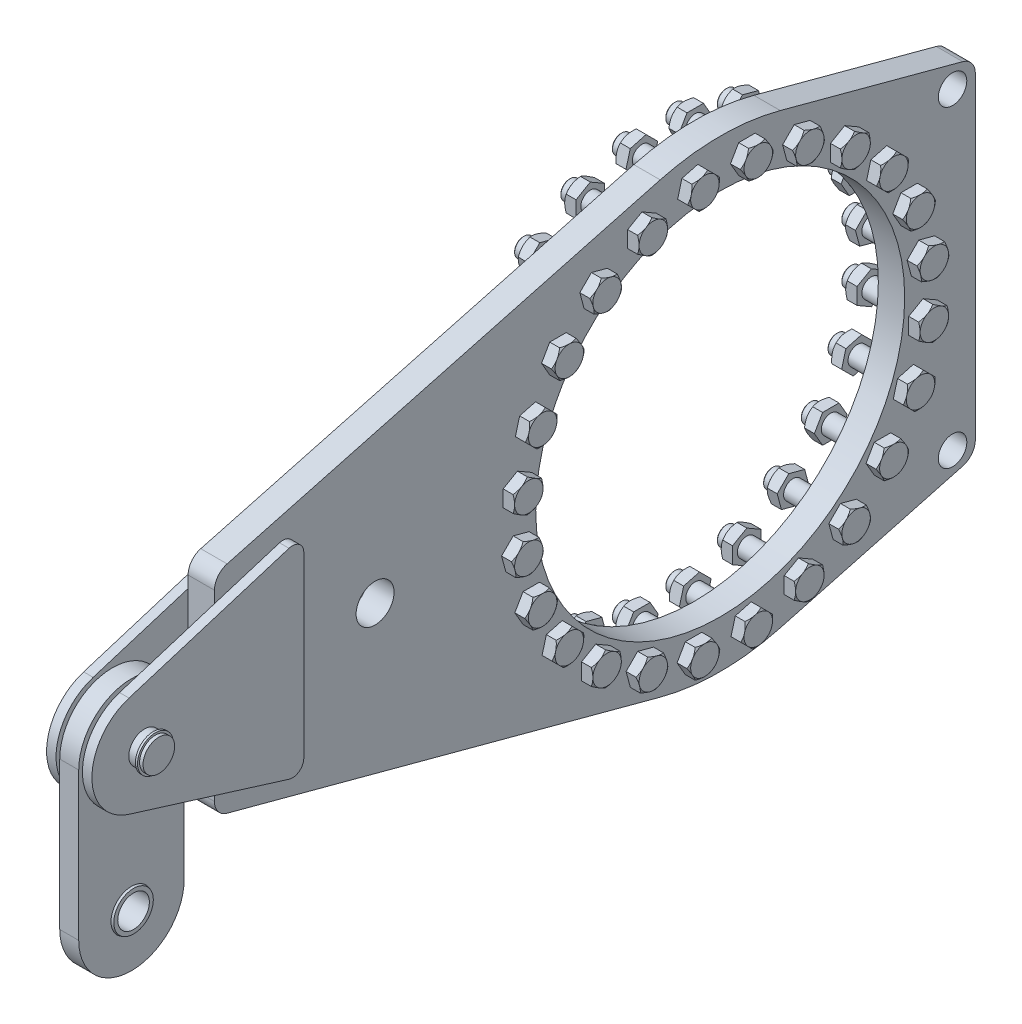
from build123d import *

# Parameters (mm, degrees)
SKETCH_3_R                            = 175
SKETCH_3_R_2                          = 13.5
SKETCH_3_R_3                          = 18
EXTRUDE_1_DEPTH                       = 12.5
EXTRUDE_START                         = 21.5
SKETCH_5_R                            = 15
EXTRUDE_2_DEPTH                       = 9
FILLET_1_R                            = 10.8
FILLET_1_OF_MIRROR_1_R                = 10.8
CUT_EXTRUDE_START                     = -12.5
SKETCH_6_R                            = 9
CUT_EXTRUDE_1_DEPTH                   = 25
PATTERN_CIRCULAR_1_COUNT              = 24
EXTRUDE_START_2                       = -9
SKETCH_7_R                            = 15
EXTRUDE_3_DEPTH                       = 18
PATTERN_LINEAR_1_COUNT                = 2
PATTERN_LINEAR_1_PITCH                = 140
EXTRUDE_3080_DEPTH                    = 10.8
SKETCH_21_R                           = 17.676914536
SKETCH_21_R_2                         = 13.5
CUT_EXTRUDE_3418_DEPTH                = 1.8
CUT_EXTRUDE_3418_DRAFT                = -55
EXTRUDE_START_3                       = -56.3
SKETCH_22_R                           = 9
EXTRUDE_6_DEPTH                       = 68.8
CHAMFER_1_SIZE                        = 0.9
EXTRUDE_START_4                       = -36.5
EXTRUDE_7_DEPTH                       = 10.8
PATTERN_CIRCULAR_2_COUNT              = 24
PATTERN_CIRCULAR_2_COPY_1_SKETCH_R    = 17.676914536
PATTERN_CIRCULAR_2_COPY_1_SKETCH_R_2  = 13.5
PATTERN_CIRCULAR_2_COPY_1_DEPTH       = 1.8
PATTERN_CIRCULAR_2_COPY_1_DRAFT       = -55
PATTERN_CIRCULAR_2_COPY_2_SKETCH_R    = 17.676914536
PATTERN_CIRCULAR_2_COPY_2_SKETCH_R_2  = 13.5
PATTERN_CIRCULAR_2_COPY_2_DEPTH       = 1.8
PATTERN_CIRCULAR_2_COPY_2_DRAFT       = -55
PATTERN_CIRCULAR_2_COPY_3_SKETCH_R    = 17.676914536
PATTERN_CIRCULAR_2_COPY_3_SKETCH_R_2  = 13.5
PATTERN_CIRCULAR_2_COPY_3_DEPTH       = 1.8
PATTERN_CIRCULAR_2_COPY_3_DRAFT       = -55
PATTERN_CIRCULAR_2_COPY_4_SKETCH_R    = 17.676914536
PATTERN_CIRCULAR_2_COPY_4_SKETCH_R_2  = 13.5
PATTERN_CIRCULAR_2_COPY_4_DEPTH       = 1.8
PATTERN_CIRCULAR_2_COPY_4_DRAFT       = -55
PATTERN_CIRCULAR_2_COPY_5_SKETCH_R    = 17.676914536
PATTERN_CIRCULAR_2_COPY_5_SKETCH_R_2  = 13.5
PATTERN_CIRCULAR_2_COPY_5_DEPTH       = 1.8
PATTERN_CIRCULAR_2_COPY_5_DRAFT       = -55
PATTERN_CIRCULAR_2_COPY_6_SKETCH_R    = 17.676914536
PATTERN_CIRCULAR_2_COPY_6_SKETCH_R_2  = 13.5
PATTERN_CIRCULAR_2_COPY_6_DEPTH       = 1.8
PATTERN_CIRCULAR_2_COPY_6_DRAFT       = -55
PATTERN_CIRCULAR_2_COPY_7_SKETCH_R    = 17.676914536
PATTERN_CIRCULAR_2_COPY_7_SKETCH_R_2  = 13.5
PATTERN_CIRCULAR_2_COPY_7_DEPTH       = 1.8
PATTERN_CIRCULAR_2_COPY_7_DRAFT       = -55
PATTERN_CIRCULAR_2_COPY_8_SKETCH_R    = 17.676914536
PATTERN_CIRCULAR_2_COPY_8_SKETCH_R_2  = 13.5
PATTERN_CIRCULAR_2_COPY_8_DEPTH       = 1.8
PATTERN_CIRCULAR_2_COPY_8_DRAFT       = -55
PATTERN_CIRCULAR_2_COPY_9_SKETCH_R    = 17.676914536
PATTERN_CIRCULAR_2_COPY_9_SKETCH_R_2  = 13.5
PATTERN_CIRCULAR_2_COPY_9_DEPTH       = 1.8
PATTERN_CIRCULAR_2_COPY_9_DRAFT       = -55
PATTERN_CIRCULAR_2_COPY_10_SKETCH_R   = 17.676914536
PATTERN_CIRCULAR_2_COPY_10_SKETCH_R_2 = 13.5
PATTERN_CIRCULAR_2_COPY_10_DEPTH      = 1.8
PATTERN_CIRCULAR_2_COPY_10_DRAFT      = -55
PATTERN_CIRCULAR_2_COPY_11_SKETCH_R   = 17.676914536
PATTERN_CIRCULAR_2_COPY_11_SKETCH_R_2 = 13.5
PATTERN_CIRCULAR_2_COPY_11_DEPTH      = 1.8
PATTERN_CIRCULAR_2_COPY_11_DRAFT      = -55
PATTERN_CIRCULAR_2_COPY_12_SKETCH_R   = 17.676914536
PATTERN_CIRCULAR_2_COPY_12_SKETCH_R_2 = 13.5
PATTERN_CIRCULAR_2_COPY_12_DEPTH      = 1.8
PATTERN_CIRCULAR_2_COPY_12_DRAFT      = -55
PATTERN_CIRCULAR_2_COPY_13_SKETCH_R   = 17.676914536
PATTERN_CIRCULAR_2_COPY_13_SKETCH_R_2 = 13.5
PATTERN_CIRCULAR_2_COPY_13_DEPTH      = 1.8
PATTERN_CIRCULAR_2_COPY_13_DRAFT      = -55
PATTERN_CIRCULAR_2_COPY_14_SKETCH_R   = 17.676914536
PATTERN_CIRCULAR_2_COPY_14_SKETCH_R_2 = 13.5
PATTERN_CIRCULAR_2_COPY_14_DEPTH      = 1.8
PATTERN_CIRCULAR_2_COPY_14_DRAFT      = -55
PATTERN_CIRCULAR_2_COPY_15_SKETCH_R   = 17.676914536
PATTERN_CIRCULAR_2_COPY_15_SKETCH_R_2 = 13.5
PATTERN_CIRCULAR_2_COPY_15_DEPTH      = 1.8
PATTERN_CIRCULAR_2_COPY_15_DRAFT      = -55
PATTERN_CIRCULAR_2_COPY_16_SKETCH_R   = 17.676914536
PATTERN_CIRCULAR_2_COPY_16_SKETCH_R_2 = 13.5
PATTERN_CIRCULAR_2_COPY_16_DEPTH      = 1.8
PATTERN_CIRCULAR_2_COPY_16_DRAFT      = -55
PATTERN_CIRCULAR_2_COPY_17_SKETCH_R   = 17.676914536
PATTERN_CIRCULAR_2_COPY_17_SKETCH_R_2 = 13.5
PATTERN_CIRCULAR_2_COPY_17_DEPTH      = 1.8
PATTERN_CIRCULAR_2_COPY_17_DRAFT      = -55
PATTERN_CIRCULAR_2_COPY_18_SKETCH_R   = 17.676914536
PATTERN_CIRCULAR_2_COPY_18_SKETCH_R_2 = 13.5
PATTERN_CIRCULAR_2_COPY_18_DEPTH      = 1.8
PATTERN_CIRCULAR_2_COPY_18_DRAFT      = -55
PATTERN_CIRCULAR_2_COPY_19_SKETCH_R   = 17.676914536
PATTERN_CIRCULAR_2_COPY_19_SKETCH_R_2 = 13.5
PATTERN_CIRCULAR_2_COPY_19_DEPTH      = 1.8
PATTERN_CIRCULAR_2_COPY_19_DRAFT      = -55
PATTERN_CIRCULAR_2_COPY_20_SKETCH_R   = 17.676914536
PATTERN_CIRCULAR_2_COPY_20_SKETCH_R_2 = 13.5
PATTERN_CIRCULAR_2_COPY_20_DEPTH      = 1.8
PATTERN_CIRCULAR_2_COPY_20_DRAFT      = -55
PATTERN_CIRCULAR_2_COPY_21_SKETCH_R   = 17.676914536
PATTERN_CIRCULAR_2_COPY_21_SKETCH_R_2 = 13.5
PATTERN_CIRCULAR_2_COPY_21_DEPTH      = 1.8
PATTERN_CIRCULAR_2_COPY_21_DRAFT      = -55
PATTERN_CIRCULAR_2_COPY_22_SKETCH_R   = 17.676914536
PATTERN_CIRCULAR_2_COPY_22_SKETCH_R_2 = 13.5
PATTERN_CIRCULAR_2_COPY_22_DEPTH      = 1.8
PATTERN_CIRCULAR_2_COPY_22_DRAFT      = -55
PATTERN_CIRCULAR_2_COPY_23_SKETCH_R   = 17.676914536
PATTERN_CIRCULAR_2_COPY_23_SKETCH_R_2 = 13.5
PATTERN_CIRCULAR_2_COPY_23_DEPTH      = 1.8
PATTERN_CIRCULAR_2_COPY_23_DRAFT      = -55
CHAMFER_1_OF_PATTERN_CIRCULAR_2_SIZE  = 0.9
FILLET_2_R                            = 16.2


# Read off the part's stored shape, not the designer's step: 切除-拉伸3
with BuildPart() as part:
    # 草图3 → 凸台-拉伸1 (new body)
    with BuildSketch(Plane(origin=(0, 0, 0), x_dir=(0, 0, -1), z_dir=(1, 0, 0))):
        with BuildLine():
            Line((-56.940189923, 212.503681784), (-479.75, 99.212134621))
            Line((-479.75, 99.212134621), (-479.75, -99.212134621))
            Line((-479.75, -99.212134621), (-56.940189923, -212.503681784))
            ThreePointArc((-56.940189923, -212.503681784), (0, -220), (56.940189923, -212.503681784))
            Line((56.940189923, -212.503681784), (242, -162.917055122))
            Line((242, -162.917055122), (242, 162.917055122))
            Line((242, 162.917055122), (56.940189923, 212.503681784))
            ThreePointArc((56.940189923, 212.503681784), (0, 220), (-56.940189923, 212.503681784))
        make_face()
        Circle(SKETCH_3_R, mode=Mode.SUBTRACT)
        with Locations((220.4, 148.375698136)):
            Circle(SKETCH_3_R_2, mode=Mode.SUBTRACT)
        with Locations((-327.375, 0)):
            Circle(SKETCH_3_R_3, mode=Mode.SUBTRACT)
        with Locations(Location((220.4, -148.375698136, 0), (0, 0, 180))):
            Circle(SKETCH_3_R_2, mode=Mode.SUBTRACT)
    extrude_1 = extrude(amount=EXTRUDE_1_DEPTH)

    # 草图5 → 凸台-拉伸2 (add)
    with BuildSketch(Plane(origin=(0, 0, 0), x_dir=(0, 0, -1), z_dir=(1, 0, 0)).offset(EXTRUDE_START)):
        with BuildLine():
            Line((-569.819319965, -47.753405698), (-404, -99.212134621))
            Line((-404, -99.212134621), (-404, 99.212134621))
            Line((-404, 99.212134621), (-569.819319965, 47.753405698))
            ThreePointArc((-569.819319965, 47.753405698), (-595.255223253, 29.656651882), (-605, 0))
            ThreePointArc((-605, 0), (-595.255223253, -29.656651882), (-569.819319965, -47.753405698))
        make_face()
        with Locations((-555, 0)):
            Circle(SKETCH_5_R, mode=Mode.SUBTRACT)
    extrude_2 = extrude(amount=-EXTRUDE_2_DEPTH)

    # 圆角1
    fillet_1_edges = [part.edges().sort_by_distance(p)[0] for p in [
        (17, -99.212134621, 404),
        (17, 99.212134621, 404),
    ]]
    fillet(fillet_1_edges, radius=FILLET_1_R)

    # 镜向1: 凸台-拉伸1, 凸台-拉伸2 across plane
    add(extrude_1.mirror(Plane(origin=(0, 0, 0), x_dir=(0, 0, 1), z_dir=(1, 0, 0))))
    add(extrude_2.mirror(Plane(origin=(0, 0, 0), x_dir=(0, 0, 1), z_dir=(1, 0, 0))))

    # 圆角1 of 镜向1
    fillet_1_of_mirror_1_edges = [part.edges().sort_by_distance(p)[0] for p in [
        (-17, -99.212134621, 404),
        (-17, 99.212134621, 404),
    ]]
    fillet(fillet_1_of_mirror_1_edges, radius=FILLET_1_OF_MIRROR_1_R)

    # 草图6 → 切除-拉伸1 (cut)
    with BuildSketch(Plane(origin=(0, 0, 0), x_dir=(0, 0, -1), z_dir=(1, 0, 0)).offset(CUT_EXTRUDE_START)):
        with Locations((25.322081291, 192.340303107)):
            Circle(SKETCH_6_R)
    cut_extrude_1 = extrude(amount=CUT_EXTRUDE_1_DEPTH, mode=Mode.SUBTRACT)

    # 阵列(圆周)1: 切除-拉伸1 ×24 about axis
    pattern_circular_1_axis = Axis((0, 0, 0), (1, 0, 0))
    for i in range(1, PATTERN_CIRCULAR_1_COUNT):
        add(cut_extrude_1.rotate(pattern_circular_1_axis, i * 360 / PATTERN_CIRCULAR_1_COUNT), mode=Mode.SUBTRACT)



with BuildPart() as body_2:
    # 草图7 → 凸台-拉伸3 (new body)
    with BuildSketch(Plane(origin=(0, 0, 0), x_dir=(0, 0, -1), z_dir=(1, 0, 0)).offset(EXTRUDE_START_2)):
        with BuildLine():
            Line((-605, 0), (-605, -140))
            ThreePointArc((-605, -140), (-555, -190), (-505, -140))
            Line((-505, -140), (-505, 0))
            ThreePointArc((-505, 0), (-555, 50), (-605, 0))
        make_face()
        with Locations((-555, 0)):
            Circle(SKETCH_7_R, mode=Mode.SUBTRACT)
        with Locations((-555, -140)):
            Circle(SKETCH_7_R, mode=Mode.SUBTRACT)
    extrude(amount=EXTRUDE_3_DEPTH)

    # 草图9 → 旋转1 (revolve)
    with BuildSketch(Plane.XY.offset(555), mode=Mode.PRIVATE) as revolve_1_sk:
        with BuildLine():
            Line((-11, 15), (-11, 18.75))
            ThreePointArc((-11, 18.75), (0, 20.625), (11, 18.75))
            Line((11, 18.75), (11, 15))
            Line((11, 15), (-11, 15))
        make_face()
    revolve_1 = revolve(revolve_1_sk.sketch.rotate(Axis((11, 0, 555), (-1, 0, 0)), 90), axis=Axis((11, 0, 555), (-1, 0, 0)))

    # 阵列(线性)1: 旋转1 ×2
    with Locations(*[(0, -i * PATTERN_LINEAR_1_PITCH, 0) for i in range(1, PATTERN_LINEAR_1_COUNT)]):
        add(revolve_1)


with BuildPart() as part_1:
    add(part.part)

    add(body_2.part)  # 旋转2 merges body 2
    # 草图12 → 旋转2 (revolve)
    with BuildSketch(Plane.XY.offset(555), mode=Mode.PRIVATE) as revolve_2_sk:
        Polygon((-35, 0), (-35, 15), (-31.75, 15), (-31.75, 17), (-29.75, 17), (-29.75, 15), (29.75, 15), (29.75, 17), (31.75, 17), (31.75, 15), (35, 15), (35, 0), align=None)
    revolve(revolve_2_sk.sketch.rotate(Axis((-35, 0, 555), (1, 0, 0)), 90), axis=Axis((-35, 0, 555), (1, 0, 0)))

    # 草图14 → Extrude 3080 (add)
    with BuildSketch(Plane(origin=(12.5, 197.357127416, 57.456147132), x_dir=(0, 0, -1), z_dir=(1, 0, 0))):
        Polygon((67.189771155, -5.016824309), (74.983999789, -18.516824309), (90.572457057, -18.516824309), (98.366685691, -5.016824309), (90.572457057, 8.483175691), (74.983999789, 8.483175691), align=None)
    extrude_3080 = extrude(amount=EXTRUDE_3080_DEPTH)


with BuildPart() as cut_extrude_3418_tool:
    # 草图21 → Cut-Extrude 3418 (with draft: the straight prism first)
    with BuildSketch(Plane(origin=(23.3, 192.340303107, -25.322081291), x_dir=(0, 0, -1), z_dir=(1, 0, 0))):
        Circle(SKETCH_21_R)
        Circle(SKETCH_21_R_2, mode=Mode.SUBTRACT)
    extrude(amount=-CUT_EXTRUDE_3418_DEPTH)
    # Cut-Extrude 3418: the draft: its side faces are tilted about the plane it starts from
    cut_extrude_3418_sides = [cut_extrude_3418_tool.faces().sort_by_distance(p)[0] for p in [
        (22.4, 192.340303107, -7.645166754),
        (22.4, 192.340303107, -11.822081291),
    ]]
    draft(cut_extrude_3418_sides, Plane(origin=(23.3, 192.340303107, -25.322081291), x_dir=(0, 0, -1), z_dir=(1, 0, 0)), CUT_EXTRUDE_3418_DRAFT)


with BuildPart() as part_2:
    add(part_1.part)

    # Cut-Extrude 3418: cut by cut_extrude_3418_tool
    add(cut_extrude_3418_tool.part, mode=Mode.SUBTRACT)

    # 草图22 → 凸台-拉伸6 (add)
    with BuildSketch(Plane(origin=(0, 0, 0), x_dir=(0, 0, -1), z_dir=(1, 0, 0)).offset(EXTRUDE_START_3)):
        with Locations((25.322081291, 192.340303107)):
            Circle(SKETCH_22_R)
    extrude_6 = extrude(amount=EXTRUDE_6_DEPTH)

    # 倒角1
    chamfer_1_edges = [part_2.edges().sort_by_distance(p)[0] for p in [
        (-56.3, 192.340303107, -16.322081291),
    ]]
    chamfer(chamfer_1_edges, length=CHAMFER_1_SIZE)

    # 草图23 → 凸台-拉伸7 (add)
    with BuildSketch(Plane(origin=(0, 0, 0), x_dir=(0, 0, -1), z_dir=(1, 0, 0)).offset(EXTRUDE_START_4)):
        Polygon((40.910538559, 192.340303107), (33.116309925, 205.840303107), (17.527852657, 205.840303107), (9.733624023, 192.340303107), (17.527852657, 178.840303107), (33.116309925, 178.840303107), align=None)
    extrude_7 = extrude(amount=-EXTRUDE_7_DEPTH)

    # 切除-拉伸3 outline → 切除-拉伸3 (revolve, cut)
    with BuildSketch(Plane(origin=(0, 192.340303107, -25.322081291), x_dir=(0, 1, 0), z_dir=(0, 0, -1))):
        Polygon((15.588457272, -45.837646475), (13.5, -47.3), (15.588457272, -47.300000159), align=None)
    cut_extrude_3 = revolve(axis=Axis((0, 192.340303107, -25.322081291), (1, 0, 0)), mode=Mode.SUBTRACT)

    # 阵列(圆周)2: Extrude 3080, 凸台-拉伸6, 凸台-拉伸7, 切除-拉伸3 ×24 about axis
    pattern_circular_2_axis = Axis((0, 0, 0), (1, 0, 0))
    add([extrude_3080.rotate(pattern_circular_2_axis, i * 360 / PATTERN_CIRCULAR_2_COUNT) for i in range(1, PATTERN_CIRCULAR_2_COUNT)])
    add([extrude_6.rotate(pattern_circular_2_axis, i * 360 / PATTERN_CIRCULAR_2_COUNT) for i in range(1, PATTERN_CIRCULAR_2_COUNT)])
    add([extrude_7.rotate(pattern_circular_2_axis, i * 360 / PATTERN_CIRCULAR_2_COUNT) for i in range(1, PATTERN_CIRCULAR_2_COUNT)])
    add([cut_extrude_3.rotate(pattern_circular_2_axis, i * 360 / PATTERN_CIRCULAR_2_COUNT) for i in range(1, PATTERN_CIRCULAR_2_COUNT)], mode=Mode.SUBTRACT)


with BuildPart() as pattern_circular_2_copy_1_tool:
    # 阵列(圆周)2 copy 1 sketch → 阵列(圆周)2 copy 1 (with draft: the straight prism first)
    with BuildSketch(Plane(origin=(23.3, 192.340303107, 25.322081291), x_dir=(0, 0.25881904510252074, -0.9659258262890683), z_dir=(1, 0, 0))):
        Circle(PATTERN_CIRCULAR_2_COPY_1_SKETCH_R)
        Circle(PATTERN_CIRCULAR_2_COPY_1_SKETCH_R_2, mode=Mode.SUBTRACT)
    extrude(amount=-PATTERN_CIRCULAR_2_COPY_1_DEPTH)
    # 阵列(圆周)2 copy 1: the draft: its side faces are tilted about the plane it starts from
    pattern_circular_2_copy_1_sides = [pattern_circular_2_copy_1_tool.faces().sort_by_distance(p)[0] for p in [
        (22.4, 187.765180966, 42.396669571),
        (22.4, 188.846245998, 38.362079945),
    ]]
    draft(pattern_circular_2_copy_1_sides, Plane(origin=(23.3, 192.340303107, 25.322081291), x_dir=(0, 0.25881904510252074, -0.9659258262890683), z_dir=(1, 0, 0)), PATTERN_CIRCULAR_2_COPY_1_DRAFT)


with BuildPart() as part_3:
    add(part_2.part)

    # 阵列(圆周)2 copy 1: cut by pattern_circular_2_copy_1_tool
    add(pattern_circular_2_copy_1_tool.part, mode=Mode.SUBTRACT)


with BuildPart() as pattern_circular_2_copy_2_tool:
    # 阵列(圆周)2 copy 2 sketch → 阵列(圆周)2 copy 2 (with draft: the straight prism first)
    with BuildSketch(Plane(origin=(23.3, 179.232629307, 74.240585879), x_dir=(0, 0.49999999999999994, -0.8660254037844387), z_dir=(1, 0, 0))):
        Circle(PATTERN_CIRCULAR_2_COPY_2_SKETCH_R)
        Circle(PATTERN_CIRCULAR_2_COPY_2_SKETCH_R_2, mode=Mode.SUBTRACT)
    extrude(amount=-PATTERN_CIRCULAR_2_COPY_2_DEPTH)
    # 阵列(圆周)2 copy 2: the draft: its side faces are tilted about the plane it starts from
    pattern_circular_2_copy_2_sides = [pattern_circular_2_copy_2_tool.faces().sort_by_distance(p)[0] for p in [
        (22.4, 170.394172039, 89.549242928),
        (22.4, 172.482629308, 85.93192883),
    ]]
    draft(pattern_circular_2_copy_2_sides, Plane(origin=(23.3, 179.232629307, 74.240585879), x_dir=(0, 0.49999999999999994, -0.8660254037844387), z_dir=(1, 0, 0)), PATTERN_CIRCULAR_2_COPY_2_DRAFT)


with BuildPart() as part_4:
    add(part_3.part)

    # 阵列(圆周)2 copy 2: cut by pattern_circular_2_copy_2_tool
    add(pattern_circular_2_copy_2_tool.part, mode=Mode.SUBTRACT)


with BuildPart() as pattern_circular_2_copy_3_tool:
    # 阵列(圆周)2 copy 3 sketch → 阵列(圆周)2 copy 3 (with draft: the straight prism first)
    with BuildSketch(Plane(origin=(23.3, 153.910548016, 118.099717228), x_dir=(0, 0.7071067811865475, -0.7071067811865476), z_dir=(1, 0, 0))):
        Circle(PATTERN_CIRCULAR_2_COPY_3_SKETCH_R)
        Circle(PATTERN_CIRCULAR_2_COPY_3_SKETCH_R_2, mode=Mode.SUBTRACT)
    extrude(amount=-PATTERN_CIRCULAR_2_COPY_3_DEPTH)
    # 阵列(圆周)2 copy 3: the draft: its side faces are tilted about the plane it starts from
    pattern_circular_2_copy_3_sides = [pattern_circular_2_copy_3_tool.faces().sort_by_distance(p)[0] for p in [
        (22.4, 141.411081877, 130.599183367),
        (22.4, 144.364606471, 127.645658774),
    ]]
    draft(pattern_circular_2_copy_3_sides, Plane(origin=(23.3, 153.910548016, 118.099717228), x_dir=(0, 0.7071067811865475, -0.7071067811865476), z_dir=(1, 0, 0)), PATTERN_CIRCULAR_2_COPY_3_DRAFT)


with BuildPart() as part_5:
    add(part_4.part)

    # 阵列(圆周)2 copy 3: cut by pattern_circular_2_copy_3_tool
    add(pattern_circular_2_copy_3_tool.part, mode=Mode.SUBTRACT)


with BuildPart() as pattern_circular_2_copy_4_tool:
    # 阵列(圆周)2 copy 4 sketch → 阵列(圆周)2 copy 4 (with draft: the straight prism first)
    with BuildSketch(Plane(origin=(23.3, 118.099717228, 153.910548017), x_dir=(0, 0.8660254037844386, -0.5000000000000001), z_dir=(1, 0, 0))):
        Circle(PATTERN_CIRCULAR_2_COPY_4_SKETCH_R)
        Circle(PATTERN_CIRCULAR_2_COPY_4_SKETCH_R_2, mode=Mode.SUBTRACT)
    extrude(amount=-PATTERN_CIRCULAR_2_COPY_4_DEPTH)
    # 阵列(圆周)2 copy 4: the draft: its side faces are tilted about the plane it starts from
    pattern_circular_2_copy_4_sides = [pattern_circular_2_copy_4_tool.faces().sort_by_distance(p)[0] for p in [
        (22.4, 102.791060179, 162.749005285),
        (22.4, 106.408374277, 160.660548017),
    ]]
    draft(pattern_circular_2_copy_4_sides, Plane(origin=(23.3, 118.099717228, 153.910548017), x_dir=(0, 0.8660254037844386, -0.5000000000000001), z_dir=(1, 0, 0)), PATTERN_CIRCULAR_2_COPY_4_DRAFT)


with BuildPart() as part_6:
    add(part_5.part)

    # 阵列(圆周)2 copy 4: cut by pattern_circular_2_copy_4_tool
    add(pattern_circular_2_copy_4_tool.part, mode=Mode.SUBTRACT)


with BuildPart() as pattern_circular_2_copy_5_tool:
    # 阵列(圆周)2 copy 5 sketch → 阵列(圆周)2 copy 5 (with draft: the straight prism first)
    with BuildSketch(Plane(origin=(23.3, 74.240585879, 179.232629307), x_dir=(0, 0.9659258262890683, -0.25881904510252074), z_dir=(1, 0, 0))):
        Circle(PATTERN_CIRCULAR_2_COPY_5_SKETCH_R)
        Circle(PATTERN_CIRCULAR_2_COPY_5_SKETCH_R_2, mode=Mode.SUBTRACT)
    extrude(amount=-PATTERN_CIRCULAR_2_COPY_5_DEPTH)
    # 阵列(圆周)2 copy 5: the draft: its side faces are tilted about the plane it starts from
    pattern_circular_2_copy_5_sides = [pattern_circular_2_copy_5_tool.faces().sort_by_distance(p)[0] for p in [
        (22.4, 57.165997599, 183.807751448),
        (22.4, 61.200587224, 182.726686416),
    ]]
    draft(pattern_circular_2_copy_5_sides, Plane(origin=(23.3, 74.240585879, 179.232629307), x_dir=(0, 0.9659258262890683, -0.25881904510252074), z_dir=(1, 0, 0)), PATTERN_CIRCULAR_2_COPY_5_DRAFT)


with BuildPart() as part_7:
    add(part_6.part)

    # 阵列(圆周)2 copy 5: cut by pattern_circular_2_copy_5_tool
    add(pattern_circular_2_copy_5_tool.part, mode=Mode.SUBTRACT)


with BuildPart() as pattern_circular_2_copy_6_tool:
    # 阵列(圆周)2 copy 6 sketch → 阵列(圆周)2 copy 6 (with draft: the straight prism first)
    with BuildSketch(Plane(origin=(23.3, 25.322081291, 192.340303107), x_dir=(0, 1, 0), z_dir=(1, 0, 0))):
        Circle(PATTERN_CIRCULAR_2_COPY_6_SKETCH_R)
        Circle(PATTERN_CIRCULAR_2_COPY_6_SKETCH_R_2, mode=Mode.SUBTRACT)
    extrude(amount=-PATTERN_CIRCULAR_2_COPY_6_DEPTH)
    # 阵列(圆周)2 copy 6: the draft: its side faces are tilted about the plane it starts from
    pattern_circular_2_copy_6_sides = [pattern_circular_2_copy_6_tool.faces().sort_by_distance(p)[0] for p in [
        (22.4, 7.645166754, 192.340303107),
        (22.4, 11.822081291, 192.340303107),
    ]]
    draft(pattern_circular_2_copy_6_sides, Plane(origin=(23.3, 25.322081291, 192.340303107), x_dir=(0, 1, 0), z_dir=(1, 0, 0)), PATTERN_CIRCULAR_2_COPY_6_DRAFT)


with BuildPart() as part_8:
    add(part_7.part)

    # 阵列(圆周)2 copy 6: cut by pattern_circular_2_copy_6_tool
    add(pattern_circular_2_copy_6_tool.part, mode=Mode.SUBTRACT)


with BuildPart() as pattern_circular_2_copy_7_tool:
    # 阵列(圆周)2 copy 7 sketch → 阵列(圆周)2 copy 7 (with draft: the straight prism first)
    with BuildSketch(Plane(origin=(23.3, -25.322081291, 192.340303107), x_dir=(0, 0.9659258262890683, 0.25881904510252085), z_dir=(1, 0, 0))):
        Circle(PATTERN_CIRCULAR_2_COPY_7_SKETCH_R)
        Circle(PATTERN_CIRCULAR_2_COPY_7_SKETCH_R_2, mode=Mode.SUBTRACT)
    extrude(amount=-PATTERN_CIRCULAR_2_COPY_7_DEPTH)
    # 阵列(圆周)2 copy 7: the draft: its side faces are tilted about the plane it starts from
    pattern_circular_2_copy_7_sides = [pattern_circular_2_copy_7_tool.faces().sort_by_distance(p)[0] for p in [
        (22.4, -42.396669571, 187.765180966),
        (22.4, -38.362079945, 188.846245998),
    ]]
    draft(pattern_circular_2_copy_7_sides, Plane(origin=(23.3, -25.322081291, 192.340303107), x_dir=(0, 0.9659258262890683, 0.25881904510252085), z_dir=(1, 0, 0)), PATTERN_CIRCULAR_2_COPY_7_DRAFT)


with BuildPart() as part_9:
    add(part_8.part)

    # 阵列(圆周)2 copy 7: cut by pattern_circular_2_copy_7_tool
    add(pattern_circular_2_copy_7_tool.part, mode=Mode.SUBTRACT)


with BuildPart() as pattern_circular_2_copy_8_tool:
    # 阵列(圆周)2 copy 8 sketch → 阵列(圆周)2 copy 8 (with draft: the straight prism first)
    with BuildSketch(Plane(origin=(23.3, -74.240585879, 179.232629307), x_dir=(0, 0.8660254037844387, 0.4999999999999998), z_dir=(1, 0, 0))):
        Circle(PATTERN_CIRCULAR_2_COPY_8_SKETCH_R)
        Circle(PATTERN_CIRCULAR_2_COPY_8_SKETCH_R_2, mode=Mode.SUBTRACT)
    extrude(amount=-PATTERN_CIRCULAR_2_COPY_8_DEPTH)
    # 阵列(圆周)2 copy 8: the draft: its side faces are tilted about the plane it starts from
    pattern_circular_2_copy_8_sides = [pattern_circular_2_copy_8_tool.faces().sort_by_distance(p)[0] for p in [
        (22.4, -89.549242928, 170.394172039),
        (22.4, -85.93192883, 172.482629308),
    ]]
    draft(pattern_circular_2_copy_8_sides, Plane(origin=(23.3, -74.240585879, 179.232629307), x_dir=(0, 0.8660254037844387, 0.4999999999999998), z_dir=(1, 0, 0)), PATTERN_CIRCULAR_2_COPY_8_DRAFT)


with BuildPart() as part_10:
    add(part_9.part)

    # 阵列(圆周)2 copy 8: cut by pattern_circular_2_copy_8_tool
    add(pattern_circular_2_copy_8_tool.part, mode=Mode.SUBTRACT)


with BuildPart() as pattern_circular_2_copy_9_tool:
    # 阵列(圆周)2 copy 9 sketch → 阵列(圆周)2 copy 9 (with draft: the straight prism first)
    with BuildSketch(Plane(origin=(23.3, -118.099717228, 153.910548016), x_dir=(0, 0.7071067811865476, 0.7071067811865475), z_dir=(1, 0, 0))):
        Circle(PATTERN_CIRCULAR_2_COPY_9_SKETCH_R)
        Circle(PATTERN_CIRCULAR_2_COPY_9_SKETCH_R_2, mode=Mode.SUBTRACT)
    extrude(amount=-PATTERN_CIRCULAR_2_COPY_9_DEPTH)
    # 阵列(圆周)2 copy 9: the draft: its side faces are tilted about the plane it starts from
    pattern_circular_2_copy_9_sides = [pattern_circular_2_copy_9_tool.faces().sort_by_distance(p)[0] for p in [
        (22.4, -130.599183367, 141.411081877),
        (22.4, -127.645658774, 144.364606471),
    ]]
    draft(pattern_circular_2_copy_9_sides, Plane(origin=(23.3, -118.099717228, 153.910548016), x_dir=(0, 0.7071067811865476, 0.7071067811865475), z_dir=(1, 0, 0)), PATTERN_CIRCULAR_2_COPY_9_DRAFT)


with BuildPart() as part_11:
    add(part_10.part)

    # 阵列(圆周)2 copy 9: cut by pattern_circular_2_copy_9_tool
    add(pattern_circular_2_copy_9_tool.part, mode=Mode.SUBTRACT)


with BuildPart() as pattern_circular_2_copy_10_tool:
    # 阵列(圆周)2 copy 10 sketch → 阵列(圆周)2 copy 10 (with draft: the straight prism first)
    with BuildSketch(Plane(origin=(23.3, -153.910548017, 118.099717228), x_dir=(0, 0.49999999999999994, 0.8660254037844387), z_dir=(1, 0, 0))):
        Circle(PATTERN_CIRCULAR_2_COPY_10_SKETCH_R)
        Circle(PATTERN_CIRCULAR_2_COPY_10_SKETCH_R_2, mode=Mode.SUBTRACT)
    extrude(amount=-PATTERN_CIRCULAR_2_COPY_10_DEPTH)
    # 阵列(圆周)2 copy 10: the draft: its side faces are tilted about the plane it starts from
    pattern_circular_2_copy_10_sides = [pattern_circular_2_copy_10_tool.faces().sort_by_distance(p)[0] for p in [
        (22.4, -162.749005285, 102.791060179),
        (22.4, -160.660548017, 106.408374277),
    ]]
    draft(pattern_circular_2_copy_10_sides, Plane(origin=(23.3, -153.910548017, 118.099717228), x_dir=(0, 0.49999999999999994, 0.8660254037844387), z_dir=(1, 0, 0)), PATTERN_CIRCULAR_2_COPY_10_DRAFT)


with BuildPart() as part_12:
    add(part_11.part)

    # 阵列(圆周)2 copy 10: cut by pattern_circular_2_copy_10_tool
    add(pattern_circular_2_copy_10_tool.part, mode=Mode.SUBTRACT)


with BuildPart() as pattern_circular_2_copy_11_tool:
    # 阵列(圆周)2 copy 11 sketch → 阵列(圆周)2 copy 11 (with draft: the straight prism first)
    with BuildSketch(Plane(origin=(23.3, -179.232629307, 74.240585879), x_dir=(0, 0.258819045102521, 0.9659258262890682), z_dir=(1, 0, 0))):
        Circle(PATTERN_CIRCULAR_2_COPY_11_SKETCH_R)
        Circle(PATTERN_CIRCULAR_2_COPY_11_SKETCH_R_2, mode=Mode.SUBTRACT)
    extrude(amount=-PATTERN_CIRCULAR_2_COPY_11_DEPTH)
    # 阵列(圆周)2 copy 11: the draft: its side faces are tilted about the plane it starts from
    pattern_circular_2_copy_11_sides = [pattern_circular_2_copy_11_tool.faces().sort_by_distance(p)[0] for p in [
        (22.4, -183.807751448, 57.165997599),
        (22.4, -182.726686416, 61.200587224),
    ]]
    draft(pattern_circular_2_copy_11_sides, Plane(origin=(23.3, -179.232629307, 74.240585879), x_dir=(0, 0.258819045102521, 0.9659258262890682), z_dir=(1, 0, 0)), PATTERN_CIRCULAR_2_COPY_11_DRAFT)


with BuildPart() as part_13:
    add(part_12.part)

    # 阵列(圆周)2 copy 11: cut by pattern_circular_2_copy_11_tool
    add(pattern_circular_2_copy_11_tool.part, mode=Mode.SUBTRACT)


with BuildPart() as pattern_circular_2_copy_12_tool:
    # 阵列(圆周)2 copy 12 sketch → 阵列(圆周)2 copy 12 (with draft: the straight prism first)
    with BuildSketch(Plane(origin=(23.3, -192.340303107, 25.322081291), x_dir=(0, 0, 1), z_dir=(1, 0, 0))):
        Circle(PATTERN_CIRCULAR_2_COPY_12_SKETCH_R)
        Circle(PATTERN_CIRCULAR_2_COPY_12_SKETCH_R_2, mode=Mode.SUBTRACT)
    extrude(amount=-PATTERN_CIRCULAR_2_COPY_12_DEPTH)
    # 阵列(圆周)2 copy 12: the draft: its side faces are tilted about the plane it starts from
    pattern_circular_2_copy_12_sides = [pattern_circular_2_copy_12_tool.faces().sort_by_distance(p)[0] for p in [
        (22.4, -192.340303107, 7.645166754),
        (22.4, -192.340303107, 11.822081291),
    ]]
    draft(pattern_circular_2_copy_12_sides, Plane(origin=(23.3, -192.340303107, 25.322081291), x_dir=(0, 0, 1), z_dir=(1, 0, 0)), PATTERN_CIRCULAR_2_COPY_12_DRAFT)


with BuildPart() as part_14:
    add(part_13.part)

    # 阵列(圆周)2 copy 12: cut by pattern_circular_2_copy_12_tool
    add(pattern_circular_2_copy_12_tool.part, mode=Mode.SUBTRACT)


with BuildPart() as pattern_circular_2_copy_13_tool:
    # 阵列(圆周)2 copy 13 sketch → 阵列(圆周)2 copy 13 (with draft: the straight prism first)
    with BuildSketch(Plane(origin=(23.3, -192.340303107, -25.322081291), x_dir=(0, -0.2588190451025208, 0.9659258262890683), z_dir=(1, 0, 0))):
        Circle(PATTERN_CIRCULAR_2_COPY_13_SKETCH_R)
        Circle(PATTERN_CIRCULAR_2_COPY_13_SKETCH_R_2, mode=Mode.SUBTRACT)
    extrude(amount=-PATTERN_CIRCULAR_2_COPY_13_DEPTH)
    # 阵列(圆周)2 copy 13: the draft: its side faces are tilted about the plane it starts from
    pattern_circular_2_copy_13_sides = [pattern_circular_2_copy_13_tool.faces().sort_by_distance(p)[0] for p in [
        (22.4, -187.765180966, -42.396669571),
        (22.4, -188.846245998, -38.362079945),
    ]]
    draft(pattern_circular_2_copy_13_sides, Plane(origin=(23.3, -192.340303107, -25.322081291), x_dir=(0, -0.2588190451025208, 0.9659258262890683), z_dir=(1, 0, 0)), PATTERN_CIRCULAR_2_COPY_13_DRAFT)


with BuildPart() as part_15:
    add(part_14.part)

    # 阵列(圆周)2 copy 13: cut by pattern_circular_2_copy_13_tool
    add(pattern_circular_2_copy_13_tool.part, mode=Mode.SUBTRACT)


with BuildPart() as pattern_circular_2_copy_14_tool:
    # 阵列(圆周)2 copy 14 sketch → 阵列(圆周)2 copy 14 (with draft: the straight prism first)
    with BuildSketch(Plane(origin=(23.3, -179.232629307, -74.240585879), x_dir=(0, -0.5000000000000001, 0.8660254037844386), z_dir=(1, 0, 0))):
        Circle(PATTERN_CIRCULAR_2_COPY_14_SKETCH_R)
        Circle(PATTERN_CIRCULAR_2_COPY_14_SKETCH_R_2, mode=Mode.SUBTRACT)
    extrude(amount=-PATTERN_CIRCULAR_2_COPY_14_DEPTH)
    # 阵列(圆周)2 copy 14: the draft: its side faces are tilted about the plane it starts from
    pattern_circular_2_copy_14_sides = [pattern_circular_2_copy_14_tool.faces().sort_by_distance(p)[0] for p in [
        (22.4, -170.394172039, -89.549242928),
        (22.4, -172.482629308, -85.93192883),
    ]]
    draft(pattern_circular_2_copy_14_sides, Plane(origin=(23.3, -179.232629307, -74.240585879), x_dir=(0, -0.5000000000000001, 0.8660254037844386), z_dir=(1, 0, 0)), PATTERN_CIRCULAR_2_COPY_14_DRAFT)


with BuildPart() as part_16:
    add(part_15.part)

    # 阵列(圆周)2 copy 14: cut by pattern_circular_2_copy_14_tool
    add(pattern_circular_2_copy_14_tool.part, mode=Mode.SUBTRACT)


with BuildPart() as pattern_circular_2_copy_15_tool:
    # 阵列(圆周)2 copy 15 sketch → 阵列(圆周)2 copy 15 (with draft: the straight prism first)
    with BuildSketch(Plane(origin=(23.3, -153.910548016, -118.099717228), x_dir=(0, -0.7071067811865475, 0.7071067811865477), z_dir=(1, 0, 0))):
        Circle(PATTERN_CIRCULAR_2_COPY_15_SKETCH_R)
        Circle(PATTERN_CIRCULAR_2_COPY_15_SKETCH_R_2, mode=Mode.SUBTRACT)
    extrude(amount=-PATTERN_CIRCULAR_2_COPY_15_DEPTH)
    # 阵列(圆周)2 copy 15: the draft: its side faces are tilted about the plane it starts from
    pattern_circular_2_copy_15_sides = [pattern_circular_2_copy_15_tool.faces().sort_by_distance(p)[0] for p in [
        (22.4, -141.411081877, -130.599183367),
        (22.4, -144.364606471, -127.645658774),
    ]]
    draft(pattern_circular_2_copy_15_sides, Plane(origin=(23.3, -153.910548016, -118.099717228), x_dir=(0, -0.7071067811865475, 0.7071067811865477), z_dir=(1, 0, 0)), PATTERN_CIRCULAR_2_COPY_15_DRAFT)


with BuildPart() as part_17:
    add(part_16.part)

    # 阵列(圆周)2 copy 15: cut by pattern_circular_2_copy_15_tool
    add(pattern_circular_2_copy_15_tool.part, mode=Mode.SUBTRACT)


with BuildPart() as pattern_circular_2_copy_16_tool:
    # 阵列(圆周)2 copy 16 sketch → 阵列(圆周)2 copy 16 (with draft: the straight prism first)
    with BuildSketch(Plane(origin=(23.3, -118.099717228, -153.910548017), x_dir=(0, -0.8660254037844384, 0.5000000000000004), z_dir=(1, 0, 0))):
        Circle(PATTERN_CIRCULAR_2_COPY_16_SKETCH_R)
        Circle(PATTERN_CIRCULAR_2_COPY_16_SKETCH_R_2, mode=Mode.SUBTRACT)
    extrude(amount=-PATTERN_CIRCULAR_2_COPY_16_DEPTH)
    # 阵列(圆周)2 copy 16: the draft: its side faces are tilted about the plane it starts from
    pattern_circular_2_copy_16_sides = [pattern_circular_2_copy_16_tool.faces().sort_by_distance(p)[0] for p in [
        (22.4, -102.791060179, -162.749005285),
        (22.4, -106.408374277, -160.660548017),
    ]]
    draft(pattern_circular_2_copy_16_sides, Plane(origin=(23.3, -118.099717228, -153.910548017), x_dir=(0, -0.8660254037844384, 0.5000000000000004), z_dir=(1, 0, 0)), PATTERN_CIRCULAR_2_COPY_16_DRAFT)


with BuildPart() as part_18:
    add(part_17.part)

    # 阵列(圆周)2 copy 16: cut by pattern_circular_2_copy_16_tool
    add(pattern_circular_2_copy_16_tool.part, mode=Mode.SUBTRACT)


with BuildPart() as pattern_circular_2_copy_17_tool:
    # 阵列(圆周)2 copy 17 sketch → 阵列(圆周)2 copy 17 (with draft: the straight prism first)
    with BuildSketch(Plane(origin=(23.3, -74.240585879, -179.232629307), x_dir=(0, -0.9659258262890683, 0.25881904510252063), z_dir=(1, 0, 0))):
        Circle(PATTERN_CIRCULAR_2_COPY_17_SKETCH_R)
        Circle(PATTERN_CIRCULAR_2_COPY_17_SKETCH_R_2, mode=Mode.SUBTRACT)
    extrude(amount=-PATTERN_CIRCULAR_2_COPY_17_DEPTH)
    # 阵列(圆周)2 copy 17: the draft: its side faces are tilted about the plane it starts from
    pattern_circular_2_copy_17_sides = [pattern_circular_2_copy_17_tool.faces().sort_by_distance(p)[0] for p in [
        (22.4, -57.165997599, -183.807751448),
        (22.4, -61.200587224, -182.726686416),
    ]]
    draft(pattern_circular_2_copy_17_sides, Plane(origin=(23.3, -74.240585879, -179.232629307), x_dir=(0, -0.9659258262890683, 0.25881904510252063), z_dir=(1, 0, 0)), PATTERN_CIRCULAR_2_COPY_17_DRAFT)


with BuildPart() as part_19:
    add(part_18.part)

    # 阵列(圆周)2 copy 17: cut by pattern_circular_2_copy_17_tool
    add(pattern_circular_2_copy_17_tool.part, mode=Mode.SUBTRACT)


with BuildPart() as pattern_circular_2_copy_18_tool:
    # 阵列(圆周)2 copy 18 sketch → 阵列(圆周)2 copy 18 (with draft: the straight prism first)
    with BuildSketch(Plane(origin=(23.3, -25.322081291, -192.340303107), x_dir=(0, -1, 0), z_dir=(1, 0, 0))):
        Circle(PATTERN_CIRCULAR_2_COPY_18_SKETCH_R)
        Circle(PATTERN_CIRCULAR_2_COPY_18_SKETCH_R_2, mode=Mode.SUBTRACT)
    extrude(amount=-PATTERN_CIRCULAR_2_COPY_18_DEPTH)
    # 阵列(圆周)2 copy 18: the draft: its side faces are tilted about the plane it starts from
    pattern_circular_2_copy_18_sides = [pattern_circular_2_copy_18_tool.faces().sort_by_distance(p)[0] for p in [
        (22.4, -7.645166754, -192.340303107),
        (22.4, -11.822081291, -192.340303107),
    ]]
    draft(pattern_circular_2_copy_18_sides, Plane(origin=(23.3, -25.322081291, -192.340303107), x_dir=(0, -1, 0), z_dir=(1, 0, 0)), PATTERN_CIRCULAR_2_COPY_18_DRAFT)


with BuildPart() as part_20:
    add(part_19.part)

    # 阵列(圆周)2 copy 18: cut by pattern_circular_2_copy_18_tool
    add(pattern_circular_2_copy_18_tool.part, mode=Mode.SUBTRACT)


with BuildPart() as pattern_circular_2_copy_19_tool:
    # 阵列(圆周)2 copy 19 sketch → 阵列(圆周)2 copy 19 (with draft: the straight prism first)
    with BuildSketch(Plane(origin=(23.3, 25.322081291, -192.340303107), x_dir=(0, -0.9659258262890684, -0.2588190451025203), z_dir=(1, 0, 0))):
        Circle(PATTERN_CIRCULAR_2_COPY_19_SKETCH_R)
        Circle(PATTERN_CIRCULAR_2_COPY_19_SKETCH_R_2, mode=Mode.SUBTRACT)
    extrude(amount=-PATTERN_CIRCULAR_2_COPY_19_DEPTH)
    # 阵列(圆周)2 copy 19: the draft: its side faces are tilted about the plane it starts from
    pattern_circular_2_copy_19_sides = [pattern_circular_2_copy_19_tool.faces().sort_by_distance(p)[0] for p in [
        (22.4, 42.396669571, -187.765180966),
        (22.4, 38.362079945, -188.846245998),
    ]]
    draft(pattern_circular_2_copy_19_sides, Plane(origin=(23.3, 25.322081291, -192.340303107), x_dir=(0, -0.9659258262890684, -0.2588190451025203), z_dir=(1, 0, 0)), PATTERN_CIRCULAR_2_COPY_19_DRAFT)


with BuildPart() as part_21:
    add(part_20.part)

    # 阵列(圆周)2 copy 19: cut by pattern_circular_2_copy_19_tool
    add(pattern_circular_2_copy_19_tool.part, mode=Mode.SUBTRACT)


with BuildPart() as pattern_circular_2_copy_20_tool:
    # 阵列(圆周)2 copy 20 sketch → 阵列(圆周)2 copy 20 (with draft: the straight prism first)
    with BuildSketch(Plane(origin=(23.3, 74.240585879, -179.232629307), x_dir=(0, -0.8660254037844386, -0.5000000000000001), z_dir=(1, 0, 0))):
        Circle(PATTERN_CIRCULAR_2_COPY_20_SKETCH_R)
        Circle(PATTERN_CIRCULAR_2_COPY_20_SKETCH_R_2, mode=Mode.SUBTRACT)
    extrude(amount=-PATTERN_CIRCULAR_2_COPY_20_DEPTH)
    # 阵列(圆周)2 copy 20: the draft: its side faces are tilted about the plane it starts from
    pattern_circular_2_copy_20_sides = [pattern_circular_2_copy_20_tool.faces().sort_by_distance(p)[0] for p in [
        (22.4, 89.549242928, -170.394172039),
        (22.4, 85.93192883, -172.482629308),
    ]]
    draft(pattern_circular_2_copy_20_sides, Plane(origin=(23.3, 74.240585879, -179.232629307), x_dir=(0, -0.8660254037844386, -0.5000000000000001), z_dir=(1, 0, 0)), PATTERN_CIRCULAR_2_COPY_20_DRAFT)


with BuildPart() as part_22:
    add(part_21.part)

    # 阵列(圆周)2 copy 20: cut by pattern_circular_2_copy_20_tool
    add(pattern_circular_2_copy_20_tool.part, mode=Mode.SUBTRACT)


with BuildPart() as pattern_circular_2_copy_21_tool:
    # 阵列(圆周)2 copy 21 sketch → 阵列(圆周)2 copy 21 (with draft: the straight prism first)
    with BuildSketch(Plane(origin=(23.3, 118.099717228, -153.910548016), x_dir=(0, -0.7071067811865477, -0.7071067811865474), z_dir=(1, 0, 0))):
        Circle(PATTERN_CIRCULAR_2_COPY_21_SKETCH_R)
        Circle(PATTERN_CIRCULAR_2_COPY_21_SKETCH_R_2, mode=Mode.SUBTRACT)
    extrude(amount=-PATTERN_CIRCULAR_2_COPY_21_DEPTH)
    # 阵列(圆周)2 copy 21: the draft: its side faces are tilted about the plane it starts from
    pattern_circular_2_copy_21_sides = [pattern_circular_2_copy_21_tool.faces().sort_by_distance(p)[0] for p in [
        (22.4, 130.599183367, -141.411081877),
        (22.4, 127.645658774, -144.364606471),
    ]]
    draft(pattern_circular_2_copy_21_sides, Plane(origin=(23.3, 118.099717228, -153.910548016), x_dir=(0, -0.7071067811865477, -0.7071067811865474), z_dir=(1, 0, 0)), PATTERN_CIRCULAR_2_COPY_21_DRAFT)


with BuildPart() as part_23:
    add(part_22.part)

    # 阵列(圆周)2 copy 21: cut by pattern_circular_2_copy_21_tool
    add(pattern_circular_2_copy_21_tool.part, mode=Mode.SUBTRACT)


with BuildPart() as pattern_circular_2_copy_22_tool:
    # 阵列(圆周)2 copy 22 sketch → 阵列(圆周)2 copy 22 (with draft: the straight prism first)
    with BuildSketch(Plane(origin=(23.3, 153.910548017, -118.099717228), x_dir=(0, -0.5000000000000004, -0.8660254037844384), z_dir=(1, 0, 0))):
        Circle(PATTERN_CIRCULAR_2_COPY_22_SKETCH_R)
        Circle(PATTERN_CIRCULAR_2_COPY_22_SKETCH_R_2, mode=Mode.SUBTRACT)
    extrude(amount=-PATTERN_CIRCULAR_2_COPY_22_DEPTH)
    # 阵列(圆周)2 copy 22: the draft: its side faces are tilted about the plane it starts from
    pattern_circular_2_copy_22_sides = [pattern_circular_2_copy_22_tool.faces().sort_by_distance(p)[0] for p in [
        (22.4, 162.749005285, -102.791060179),
        (22.4, 160.660548017, -106.408374277),
    ]]
    draft(pattern_circular_2_copy_22_sides, Plane(origin=(23.3, 153.910548017, -118.099717228), x_dir=(0, -0.5000000000000004, -0.8660254037844384), z_dir=(1, 0, 0)), PATTERN_CIRCULAR_2_COPY_22_DRAFT)


with BuildPart() as part_24:
    add(part_23.part)

    # 阵列(圆周)2 copy 22: cut by pattern_circular_2_copy_22_tool
    add(pattern_circular_2_copy_22_tool.part, mode=Mode.SUBTRACT)


with BuildPart() as pattern_circular_2_copy_23_tool:
    # 阵列(圆周)2 copy 23 sketch → 阵列(圆周)2 copy 23 (with draft: the straight prism first)
    with BuildSketch(Plane(origin=(23.3, 179.232629307, -74.240585879), x_dir=(0, -0.2588190451025207, -0.9659258262890683), z_dir=(1, 0, 0))):
        Circle(PATTERN_CIRCULAR_2_COPY_23_SKETCH_R)
        Circle(PATTERN_CIRCULAR_2_COPY_23_SKETCH_R_2, mode=Mode.SUBTRACT)
    extrude(amount=-PATTERN_CIRCULAR_2_COPY_23_DEPTH)
    # 阵列(圆周)2 copy 23: the draft: its side faces are tilted about the plane it starts from
    pattern_circular_2_copy_23_sides = [pattern_circular_2_copy_23_tool.faces().sort_by_distance(p)[0] for p in [
        (22.4, 183.807751448, -57.165997599),
        (22.4, 182.726686416, -61.200587224),
    ]]
    draft(pattern_circular_2_copy_23_sides, Plane(origin=(23.3, 179.232629307, -74.240585879), x_dir=(0, -0.2588190451025207, -0.9659258262890683), z_dir=(1, 0, 0)), PATTERN_CIRCULAR_2_COPY_23_DRAFT)


with BuildPart() as part_25:
    add(part_24.part)

    # 阵列(圆周)2 copy 23: cut by pattern_circular_2_copy_23_tool
    add(pattern_circular_2_copy_23_tool.part, mode=Mode.SUBTRACT)

    # 倒角1 of 阵列(圆周)2
    chamfer_1_of_pattern_circular_2_edges = [part_25.edges().sort_by_distance(p)[0] for p in [
        (-56.3, 190.010931701, 34.015413727),
        (-56.3, 174.732629307, 82.034814513),
        (-56.3, 147.546586986, 124.463678258),
        (-56.3, 110.305488594, 158.410548017),
        (-56.3, 65.547253442, 181.562000713),
        (-56.3, 16.322081291, 192.340303107),
        (-56.3, -34.015413727, 190.010931701),
        (-56.3, -82.034814513, 174.732629307),
        (-56.3, -124.463678258, 147.546586986),
        (-56.3, -158.410548017, 110.305488594),
        (-56.3, -181.562000713, 65.547253442),
        (-56.3, -192.340303107, 16.322081291),
        (-56.3, -190.010931701, -34.015413727),
        (-56.3, -174.732629307, -82.034814513),
        (-56.3, -147.546586986, -124.463678258),
        (-56.3, -110.305488594, -158.410548017),
        (-56.3, -65.547253442, -181.562000713),
        (-56.3, -16.322081291, -192.340303107),
        (-56.3, 34.015413727, -190.010931701),
        (-56.3, 82.034814513, -174.732629307),
        (-56.3, 124.463678258, -147.546586986),
        (-56.3, 158.410548017, -110.305488594),
        (-56.3, 181.562000713, -65.547253442),
    ]]
    chamfer(chamfer_1_of_pattern_circular_2_edges, length=CHAMFER_1_OF_PATTERN_CIRCULAR_2_SIZE)

    # 圆角2
    fillet_2_edges = [part_25.edges().sort_by_distance(p)[0] for p in [
        (0, 162.917055122, -242),
        (0, -162.917055122, -242),
        (0, -99.212134621, 479.75),
        (0, 99.212134621, 479.75),
    ]]
    fillet(fillet_2_edges, radius=FILLET_2_R)


solid = part_25.part
